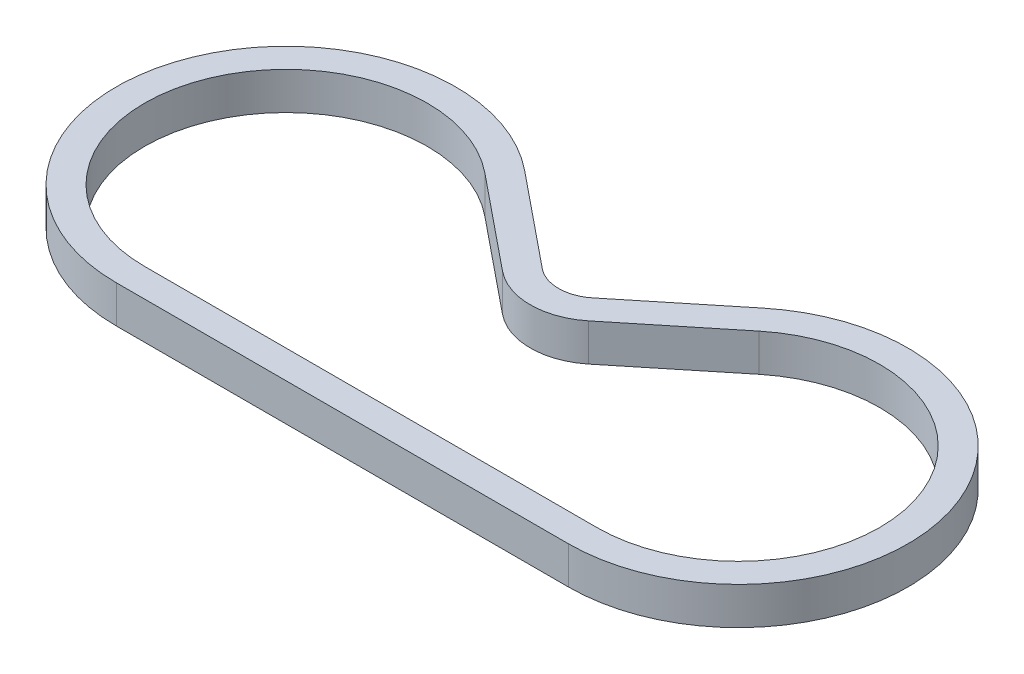
from build123d import *

# Parameters (mm, degrees)
BOSS_EXTRUDE1_DEPTH = 7.7978


with BuildPart() as part:
    # Sketch1 → Boss-Extrude1 (new body)
    with BuildSketch(Plane(origin=(0, 0, 0), x_dir=(1, 0, 0), z_dir=(0, 1, 0))):
        with BuildLine():
            ThreePointArc((24.825593139, 27.434914191), (35.282438586, 33.304188324), (47.1, 35.3387))
            ThreePointArc((47.1, 35.3387), (82.4387, 0), (47.1, -35.3387))
            Line((47.1, -35.3387), (-47.1, -35.3387))
            ThreePointArc((-47.1, -35.3387), (-82.4387, 0), (-47.1, 35.3387))
            ThreePointArc((-47.1, 35.3387), (-35.282438586, 33.304188324), (-24.825593139, 27.434914191))
            Line((-24.825593139, 27.434914191), (-5.246181367, 11.538389753))
            ThreePointArc((-5.246181367, 11.538389753), (0, 9.67685), (5.246181367, 11.538389753))
            Line((5.246181367, 11.538389753), (24.825593139, 27.434914191))
        make_face()
        with BuildLine():
            Line((28.539895724, 22.860086528), (8.960483951, 6.963562089))
            ThreePointArc((8.960483951, 6.963562089), (0, 3.78405), (-8.960483951, 6.963562089))
            Line((-8.960483951, 6.963562089), (-28.539895724, 22.860086528))
            ThreePointArc((-28.539895724, 22.860086528), (-37.253040954, 27.750647278), (-47.1, 29.4459))
            ThreePointArc((-47.1, 29.4459), (-76.5459, 0), (-47.1, -29.4459))
            Line((-47.1, -29.4459), (47.1, -29.4459))
            ThreePointArc((47.1, -29.4459), (76.5459, 0), (47.1, 29.4459))
            ThreePointArc((47.1, 29.4459), (37.253040954, 27.750647278), (28.539895724, 22.860086528))
        make_face(mode=Mode.SUBTRACT)
    extrude(amount=BOSS_EXTRUDE1_DEPTH)


solid = part.part
